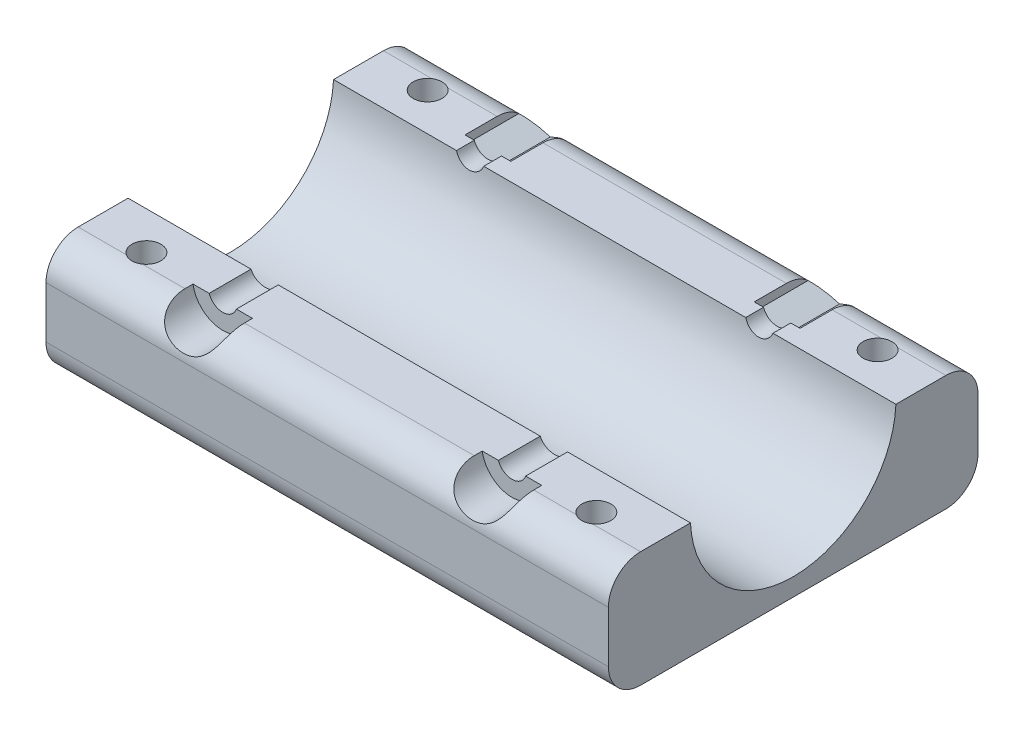
from build123d import *

# Parameters (mm, degrees)
BOSS_EXTRUDE1_DEPTH     = 35
CUT_EXTRUDE1_DEPTH      = 45.485952839
CUT_EXTRUDE1_DEPTH_BACK = 45.485952839
SKETCH2_R               = 12.8
SKETCH3_R               = 1.8
CUT_EXTRUDE2_DEPTH      = 16
SKETCH4_R               = 3.25
CUT_EXTRUDE3_DEPTH      = 5.6
CUT_EXTRUDE4_DEPTH      = 45.485953003
CUT_EXTRUDE4_DEPTH_BACK = 45.485953003
SKETCH5_R               = 1.8
SKETCH6_R               = 3.75
CUT_EXTRUDE5_DEPTH      = 5
CUT_EXTRUDE6_DEPTH      = 8


with BuildPart() as part:
    # Sketch1 → Boss-Extrude1 (new, symmetric)
    with BuildSketch(Plane(origin=(0, 0, 0), x_dir=(0, 0, -1), z_dir=(1, 0, 0))):
        with BuildLine():
            Line((-19, -15), (19, -15))
            ThreePointArc((19, -15), (21.828427125, -13.828427125), (23, -11))
            Line((23, -11), (23, -4.6))
            ThreePointArc((23, -4.6), (21.828427125, -1.771572875), (19, -0.6))
            Line((19, -0.6), (-19, -0.6))
            ThreePointArc((-19, -0.6), (-21.828427125, -1.771572875), (-23, -4.6))
            Line((-23, -4.6), (-23, -11))
            ThreePointArc((-23, -11), (-21.828427125, -13.828427125), (-19, -15))
        make_face()
    extrude(amount=BOSS_EXTRUDE1_DEPTH, both=True)

    # Sketch2 → Cut-Extrude1 (cut, two sides: drawn at the far end of the back side and taken through both)
    with BuildSketch(Plane(origin=(0, 0, 0), x_dir=(0, 0, -1), z_dir=(1, 0, 0)).offset(-CUT_EXTRUDE1_DEPTH_BACK)):
        Circle(SKETCH2_R)
    extrude(amount=CUT_EXTRUDE1_DEPTH + CUT_EXTRUDE1_DEPTH_BACK, mode=Mode.SUBTRACT)

    # Sketch3 → Cut-Extrude2 (cut)
    with BuildSketch(Plane(origin=(0, -15, 0), x_dir=(1, 0, 0), z_dir=(0, 1, 0))):
        with Locations((28, -17.5)):
            Circle(SKETCH3_R)
        with Locations((28, 17.5)):
            Circle(SKETCH3_R)
        with Locations((-28, -17.5)):
            Circle(SKETCH3_R)
        with Locations((-28, 17.5)):
            Circle(SKETCH3_R)
    extrude(amount=CUT_EXTRUDE2_DEPTH, mode=Mode.SUBTRACT)

    # Sketch4 → Cut-Extrude3 (cut)
    with BuildSketch(Plane(origin=(0, -15, 0), x_dir=(1, 0, 0), z_dir=(0, 1, 0))):
        with Locations((28, -17.5)):
            Circle(SKETCH4_R)
        with Locations((28, 17.5)):
            Circle(SKETCH4_R)
        with Locations((-28, -17.5)):
            Circle(SKETCH4_R)
        with Locations((-28, 17.5)):
            Circle(SKETCH4_R)
    extrude(amount=CUT_EXTRUDE3_DEPTH, mode=Mode.SUBTRACT)

    # Sketch5 → Cut-Extrude4 (cut, two sides: drawn at the far end of the back side and taken through both)
    with BuildSketch(Plane.XY.offset(-CUT_EXTRUDE4_DEPTH_BACK)):
        with Locations((18, 0)):
            Circle(SKETCH5_R)
        with Locations((-18, 0)):
            Circle(SKETCH5_R)
    extrude(amount=CUT_EXTRUDE4_DEPTH + CUT_EXTRUDE4_DEPTH_BACK, mode=Mode.SUBTRACT)

    # Sketch6 → Cut-Extrude5 (cut)
    with BuildSketch(Plane.XY.offset(23)):
        with Locations((18, 0)):
            Circle(SKETCH6_R)
        with Locations((-18, 0)):
            Circle(SKETCH6_R)
    extrude(amount=-CUT_EXTRUDE5_DEPTH, mode=Mode.SUBTRACT)

    # Sketch7 → Cut-Extrude6 (cut)
    with BuildSketch(Plane.XY.offset(-23)):
        Polygon((20.85, 1.645448267), (18, 3.290896534), (15.15, 1.645448267), (15.15, -1.645448267), (18, -3.290896534), (20.85, -1.645448267), align=None)
        Polygon((-15.15, 1.645448267), (-18, 3.290896534), (-20.85, 1.645448267), (-20.85, -1.645448267), (-18, -3.290896534), (-15.15, -1.645448267), align=None)
    extrude(amount=CUT_EXTRUDE6_DEPTH, mode=Mode.SUBTRACT)


solid = part.part
